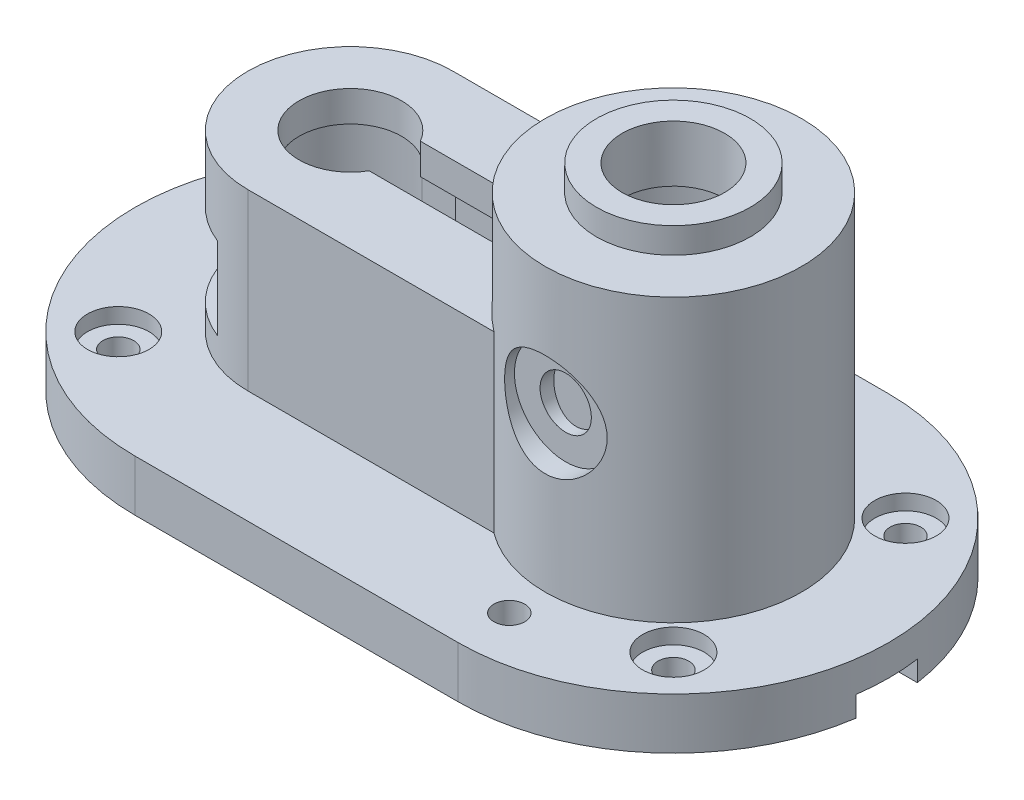
from build123d import *
from build123d.topology import SkipClean

# Parameters (mm, degrees)
EXTRUDE_1_DEPTH                       = 10
SKETCH_2_R                            = 6
SKETCH_2_R_2                          = 3
CUT_EXTRUDE_1_DEPTH                   = 3
SKETCH_2_2_R                          = 3
CUT_EXTRUDE_2_DEPTH                   = 86.242301705
EXTRUDE_2_DEPTH                       = 34
SKETCH_3_3_R                          = 25
EXTRUDE_3_DEPTH                       = 55
SHELL_START                           = 10
SHELL_9_DEPTH                         = 28
SHELL_START_2                         = 38
SHELL_9_2_OUTLINE_R                   = 19
SHELL_9_2_DEPTH                       = 21
SKETCH_5_R                            = 19
CUT_EXTRUDE_5_DEPTH                   = 10
SKETCH_6_R                            = 10
CUT_EXTRUDE_6_DEPTH                   = 6
SKETCH_7_R                            = 15
SKETCH_7_R_2                          = 10
EXTRUDE_4_DEPTH                       = 5
CUT_EXTRUDE_START                     = 25
SKETCH_8_R                            = 10
SKETCH_8_R_2                          = 5
CUT_EXTRUDE_7_DEPTH                   = 4
SKETCH_8_2_R                          = 5
CUT_EXTRUDE_8_DEPTH                   = 110.846483785
SKETCH_9_R                            = 10
CUT_EXTRUDE_9_DEPTH                   = 6
EXTRUDE_START                         = -14
SKETCH_10_W                           = 42.154767421
SKETCH_10_H                           = 38
EXTRUDE_5_DEPTH                       = 1.5
EXTRUDE_START_2                       = 14
SKETCH_10_2_W                         = 42.154767421
SKETCH_10_2_H                         = 38
EXTRUDE_6_DEPTH                       = 1.5
SKETCH_11_R                           = 19
CUT_EXTRUDE_10_DEPTH                  = 104.185512549
CUT_EXTRUDE_START_2                   = 49.527756
SKETCH_12_W                           = 12
SKETCH_12_H                           = 4
CUT_EXTRUDE_11_DEPTH                  = 23.972244
SKETCH_13_R                           = 3
CUT_EXTRUDE_13_DEPTH                  = 110.846483785
CUT_EXTRUDE_14_REACH                  = 141.071
CUT_EXTRUDE_14_END_RADIUS             = 14
SKETCH_15_W                           = 16
SKETCH_15_H                           = 16
CUT_EXTRUDE_14_DIRECTION_2_REACH      = 141.071
CUT_EXTRUDE_14_DIRECTION_2_END_RADIUS = 20


# Read off the part's stored shape, not the designer's step: 抽壳9
with BuildPart() as part:
    # 草图1 → 凸台-拉伸1 (new body)
    with BuildSketch(Plane(origin=(0, 0, 0), x_dir=(1, 0, 0), z_dir=(0, 1, 0))):
        with BuildLine():
            Line((-31.5, 42), (31.5, 42))
            ThreePointArc((31.5, 42), (73.5, 0), (31.5, -42))
            Line((31.5, -42), (-31.5, -42))
            ThreePointArc((-31.5, -42), (-73.5, 0), (-31.5, 42))
        make_face()
    extrude(amount=EXTRUDE_1_DEPTH)

    # 草图2 → 切除-拉伸1 (cut)
    # profile 1 of 4: a face of its own
    with BuildSketch(Plane(origin=(0, 10, 0), x_dir=(1, 0, 0), z_dir=(0, 1, 0))):
        with Locations(Location((54.127416998, 22.627416998, 0), (0, 0, 270))):
            Circle(SKETCH_2_R)
        with Locations(Location((54.127416998, 22.627416998, 0), (0, 0, 270))):
            Circle(SKETCH_2_R_2, mode=Mode.SUBTRACT)
    # profile 2 of 4: a face of its own
    with BuildSketch(Plane(origin=(0, 10, 0), x_dir=(1, 0, 0), z_dir=(0, 1, 0))):
        with Locations(Location((54.127416998, -22.627416998, 0), (0, 0, 90))):
            Circle(SKETCH_2_R)
        with Locations(Location((54.127416998, -22.627416998, 0), (0, 0, 90))):
            Circle(SKETCH_2_R_2, mode=Mode.SUBTRACT)
    # profile 3 of 4: a face of its own
    with BuildSketch(Plane(origin=(0, 10, 0), x_dir=(1, 0, 0), z_dir=(0, 1, 0))):
        with Locations(Location((-54.127416998, -22.627416998, 0), (0, 0, 270))):
            Circle(SKETCH_2_R)
        with Locations(Location((-54.127416998, -22.627416998, 0), (0, 0, 270))):
            Circle(SKETCH_2_R_2, mode=Mode.SUBTRACT)
    # profile 4 of 4: a face of its own
    with BuildSketch(Plane(origin=(0, 10, 0), x_dir=(1, 0, 0), z_dir=(0, 1, 0))):
        with Locations(Location((-54.127416998, 22.627416998, 0), (0, 0, 90))):
            Circle(SKETCH_2_R)
        with Locations(Location((-54.127416998, 22.627416998, 0), (0, 0, 90))):
            Circle(SKETCH_2_R_2, mode=Mode.SUBTRACT)
    extrude(amount=-CUT_EXTRUDE_1_DEPTH, mode=Mode.SUBTRACT)

    # 草图2<2> → 切除-拉伸2 (cut, through all)
    with BuildSketch(Plane(origin=(0, 10, 0), x_dir=(1, 0, 0), z_dir=(0, 1, 0))):
        with Locations(Location((-54.127416998, -22.627416998, 0), (0, 0, 270))):
            Circle(SKETCH_2_2_R)
        with Locations(Location((-54.127416998, 22.627416998, 0), (0, 0, 270))):
            Circle(SKETCH_2_2_R)
        with Locations(Location((54.127416998, 22.627416998, 0), (0, 0, 270))):
            Circle(SKETCH_2_2_R)
        with Locations(Location((54.127416998, -22.627416998, 0), (0, 0, 270))):
            Circle(SKETCH_2_2_R)
    extrude(amount=-CUT_EXTRUDE_2_DEPTH, mode=Mode.SUBTRACT)

    # 草图5 → 切除-拉伸5 (cut)
    with BuildSketch(Plane(origin=(0, 0, 0), x_dir=(1, 0, 0), z_dir=(0, 1, 0))):
        with Locations(Location((31.5, 0, 0), (0, 0, 132.536898363))):
            Circle(SKETCH_5_R)
        with BuildLine():
            Line((18.654767421, -14), (-31.5, -14))
            ThreePointArc((-31.5, -14), (-45.5, 0), (-31.5, 14))
            Line((-31.5, 14), (18.654767421, 14))
            ThreePointArc((18.654767421, 14), (12.5, 0), (18.654767421, -14))
        make_face()
    extrude(amount=CUT_EXTRUDE_5_DEPTH, mode=Mode.SUBTRACT)



with BuildPart() as body_2:
    # 草图3 → 凸台-拉伸2 (new body)
    with BuildSketch(Plane(origin=(0, 10, 0), x_dir=(1, 0, 0), z_dir=(0, 1, 0))):
        with BuildLine():
            Line((16.5, 20), (-31.5, 20))
            ThreePointArc((-31.5, 20), (-51.5, 0), (-31.5, -20))
            Line((-31.5, -20), (16.5, -20))
            ThreePointArc((16.5, -20), (6.5, 0), (16.5, 20))
        make_face()
    extrude(amount=EXTRUDE_2_DEPTH)


with BuildPart() as body_3:
    # 草图3<3> → 凸台-拉伸3 (new body)
    with BuildSketch(Plane(origin=(0, 10, 0), x_dir=(1, 0, 0), z_dir=(0, 1, 0))):
        with Locations(Location((31.5, 0, 0), (0, 0, 270))):
            Circle(SKETCH_3_3_R)
    extrude(amount=EXTRUDE_3_DEPTH)


with BuildPart() as body_2_1:
    add(body_2.part)

    # Combine 1: union body 3
    add(body_3.part)

    # 抽壳9 outline → 抽壳9 (cut)
    with BuildSketch(Plane(origin=(0, 0, 0), x_dir=(1, 0, 0), z_dir=(0, 1, 0)).offset(SHELL_START)):
        with BuildLine():
            Line((-31.5, -14), (18.654767421, -14))
            ThreePointArc((18.654767421, -14), (50.5, 0), (18.654767421, 14))
            Line((18.654767421, 14), (-31.5, 14))
            ThreePointArc((-31.5, 14), (-45.5, 0), (-31.5, -14))
        make_face()
    extrude(amount=SHELL_9_DEPTH, mode=Mode.SUBTRACT)

    # Shell 9 2 outline → Shell 9 2 (cut)
    with BuildSketch(Plane(origin=(0, 0, 0), x_dir=(1, 0, 0), z_dir=(0, 1, 0)).offset(SHELL_START_2)):
        with Locations((31.5, 0)):
            Circle(SHELL_9_2_OUTLINE_R)
    extrude(amount=SHELL_9_2_DEPTH, mode=Mode.SUBTRACT)

    # 草图6 → 切除-拉伸6 (cut)
    with BuildSketch(Plane.XZ.offset(-59)):
        with Locations(Location((31.5, 0, 0), (0, 0, 270))):
            Circle(SKETCH_6_R)
    extrude(amount=-CUT_EXTRUDE_6_DEPTH, mode=Mode.SUBTRACT)

    # 草图7 → 凸台-拉伸4 (add)
    with BuildSketch(Plane(origin=(0, 65, 0), x_dir=(1, 0, 0), z_dir=(0, 1, 0))):
        with Locations(Location((31.5, 0, 0), (0, 0, 270))):
            Circle(SKETCH_7_R)
        with Locations(Location((31.5, 0, 0), (0, 0, 90))):
            Circle(SKETCH_7_R_2, mode=Mode.SUBTRACT)
    extrude(amount=EXTRUDE_4_DEPTH)

    # 草图8 → 切除-拉伸7 (cut)
    with BuildSketch(Plane.XY.offset(CUT_EXTRUDE_START)):
        with Locations((31.5, 40)):
            Circle(SKETCH_8_R)
        with Locations((31.5, 40)):
            Circle(SKETCH_8_R_2, mode=Mode.SUBTRACT)
    extrude(amount=-CUT_EXTRUDE_7_DEPTH, mode=Mode.SUBTRACT)

    # 草图8<2> → 切除-拉伸8 (cut, through all)
    with BuildSketch(Plane.XY):
        with Locations(Location((31.5, 40, 0), (0, 0, 180))):
            Circle(SKETCH_8_2_R)
    extrude(amount=CUT_EXTRUDE_8_DEPTH, mode=Mode.SUBTRACT)

    # 草图9 → 切除-拉伸9 (cut)
    with BuildSketch(Plane(origin=(0, 44, 0), x_dir=(1, 0, 0), z_dir=(0, 1, 0))):
        with Locations((-31.5, 0)):
            Circle(SKETCH_9_R)
        with BuildLine():
            Line((-31.5, 5), (0.5, 5))
            ThreePointArc((0.5, 5), (5.5, 0), (0.5, -5))
            Line((0.5, -5), (-31.5, -5))
            ThreePointArc((-31.5, -5), (-36.5, 0), (-31.5, 5))
        make_face()
    extrude(amount=-CUT_EXTRUDE_9_DEPTH, mode=Mode.SUBTRACT)


with BuildPart() as part_1:
    add(part.part)

    add(body_2_1.part)  # 凸台-拉伸5 merges body 2
    # 草图10 → 凸台-拉伸5 (add)
    with BuildSketch(Plane.XY.offset(EXTRUDE_START)):
        with Locations((-2.422616289, 19)):
            Rectangle(SKETCH_10_W, SKETCH_10_H)
    extrude(amount=EXTRUDE_5_DEPTH)

    # 草图10<2> → 凸台-拉伸6 (add)
    with BuildSketch(Plane.XY.offset(EXTRUDE_START_2)):
        with Locations((-2.422616289, 19)):
            Rectangle(SKETCH_10_2_W, SKETCH_10_2_H)
    extrude(amount=-EXTRUDE_6_DEPTH)

    # 草图11 → 切除-拉伸10 (cut, through all)
    with SkipClean():  # the faces are left unmerged after this step: merging them gives an invalid solid
        with BuildSketch(Plane.XZ.offset(-59)):
            with Locations(Location((31.5, 0, 0), (0, 0, 221.139510415))):
                Circle(SKETCH_11_R)
        extrude(amount=CUT_EXTRUDE_10_DEPTH, mode=Mode.SUBTRACT)

    # 草图12 → 切除-拉伸11 (cut)
    with SkipClean():  # the faces are left unmerged after this step: merging them gives an invalid solid
        with BuildSketch(Plane(origin=(0, 0, 0), x_dir=(0, 0, -1), z_dir=(1, 0, 0)).offset(CUT_EXTRUDE_START_2)):
            with Locations((0, 2)):
                Rectangle(SKETCH_12_W, SKETCH_12_H)
        extrude(amount=CUT_EXTRUDE_11_DEPTH, mode=Mode.SUBTRACT)

    # 草图13 → 切除-拉伸13 (cut, through all)
    with SkipClean():  # the faces are left unmerged after this step: merging them gives an invalid solid
        with BuildSketch(Plane(origin=(0, 0, 0), x_dir=(1, 0, 0), z_dir=(0, 1, 0))):
            with Locations(Location((-31.5, 32, 0), (0, 0, 270))):
                Circle(SKETCH_13_R)
            with Locations(Location((31.5, -32, 0), (0, 0, 270))):
                Circle(SKETCH_13_R)
        extrude(amount=CUT_EXTRUDE_13_DEPTH, mode=Mode.SUBTRACT)

    # 切除-拉伸14: up to this cylinder (the profile starts outside it)
    with SkipClean():  # the faces are left unmerged after this step: merging them gives an invalid solid
        cut_extrude_14_end = Plane(origin=(-31.5, 23, 0), z_dir=(0, -1, 0)) * Cylinder(CUT_EXTRUDE_14_END_RADIUS, 311.142, mode=Mode.PRIVATE)
        # 草图15 → 切除-拉伸14 (cut, up to the surface)
        with BuildSketch(Plane(origin=(-25.75, 0, 25.75), x_dir=(0, -1, 0), z_dir=(-0.7071067811865488, 0, 0.7071067811865464)), mode=Mode.PRIVATE) as cut_extrude_14_sk1:
            with Locations((-23, -22.273863607)):
                Rectangle(SKETCH_15_W, SKETCH_15_H)
        cut_extrude_14_tool1 = extrude(cut_extrude_14_sk1.sketch, amount=-CUT_EXTRUDE_14_REACH, mode=Mode.PRIVATE) - cut_extrude_14_end
        add(cut_extrude_14_tool1.solids().sort_by_distance((-41.5, 23, 10))[0], mode=Mode.SUBTRACT)

    # 切除-拉伸14 direction 2: up to this cylinder (the profile starts inside it)
    with SkipClean():  # the faces are left unmerged after this step: merging them gives an invalid solid
        cut_extrude_14_direction_2_end = Plane(origin=(-31.5, 23, 0), z_dir=(0, -1, 0)) * Cylinder(CUT_EXTRUDE_14_DIRECTION_2_END_RADIUS, 323.142, mode=Mode.PRIVATE)
        # 草图15 → 切除-拉伸14 direction 2 (cut, up to the surface)
        with BuildSketch(Plane(origin=(-25.75, 0, 25.75), x_dir=(0, -1, 0), z_dir=(-0.7071067811865488, 0, 0.7071067811865464)), mode=Mode.PRIVATE) as cut_extrude_14_direction_2_sk1:
            with Locations((-23, -22.273863607)):
                Rectangle(SKETCH_15_W, SKETCH_15_H)
        cut_extrude_14_direction_2_tool1 = extrude(cut_extrude_14_direction_2_sk1.sketch, amount=CUT_EXTRUDE_14_DIRECTION_2_REACH, mode=Mode.PRIVATE) & cut_extrude_14_direction_2_end
        add(cut_extrude_14_direction_2_tool1.solids().sort_by_distance((-41.5, 23, 10))[0], mode=Mode.SUBTRACT)


solid = part_1.part
